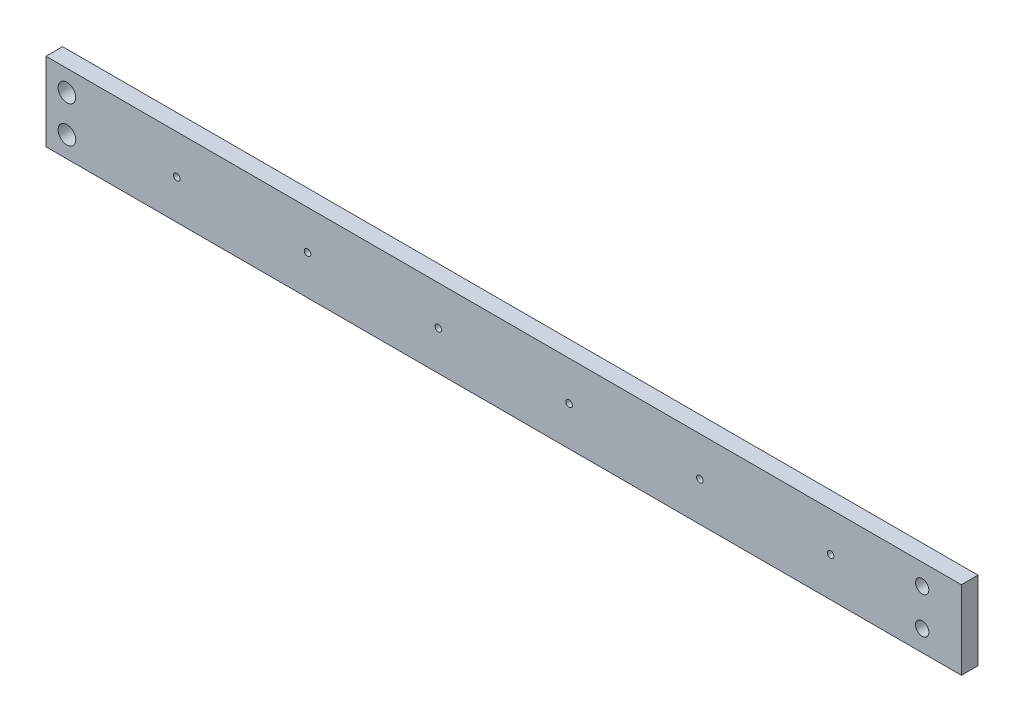
from build123d import *

# Parameters (mm, degrees)
SKETCH2_W                   = 350
SKETCH2_H                   = 30
BOSS_EXTRUDE1_DEPTH         = 6.35
F_1_4_CLEARANCE_HOLE1_D     = 6.7564
TAP_DRILL_FOR_M3X0_5_TAP1_D = 2.5
LPATTERN1_COUNT             = 6
LPATTERN1_PITCH             = 50
TAP_DRILL_FOR_1_4_20_TAP1_D = 5.1054


with BuildPart() as part:
    # Sketch2 → Boss-Extrude1 (new body)
    with BuildSketch(Plane.XY):
        with Locations((175, 15)):
            Rectangle(SKETCH2_W, SKETCH2_H)
    extrude(amount=BOSS_EXTRUDE1_DEPTH)

    # 1/4 Clearance Hole1 (through all)
    with Locations(Plane.XY.offset(6.35)):
        with Locations((8, 22), (8, 8)):
            Hole(F_1_4_CLEARANCE_HOLE1_D / 2)

    # Tap Drill for M3x0.5 Tap1 (through all)
    with Locations(Plane.XY.offset(6.35)):
        with Locations((50, 15)):
            tap_drill_for_m3x0_5_tap1 = Hole(TAP_DRILL_FOR_M3X0_5_TAP1_D / 2)

    # LPattern1: Tap Drill for M3x0.5 Tap1 ×6
    with Locations(*[(i * LPATTERN1_PITCH, 0, 0) for i in range(1, LPATTERN1_COUNT)]):
        add(tap_drill_for_m3x0_5_tap1, mode=Mode.SUBTRACT)

    # Tap Drill for 1/4-20 Tap1 (through all)
    with Locations(Plane(origin=(0, 0, 0), x_dir=(-1, 0, 0), z_dir=(0, 0, -1))):
        with Locations((-335, 22), (-335, 8)):
            Hole(TAP_DRILL_FOR_1_4_20_TAP1_D / 2)


solid = part.part
